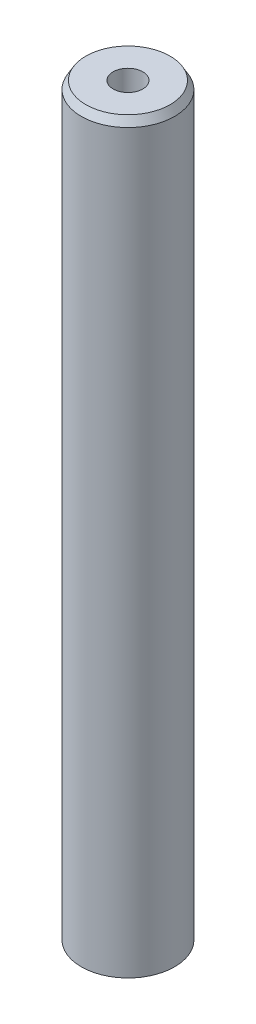
from build123d import *
from OCP.BRepFilletAPI import BRepFilletAPI_MakeChamfer

# Parameters (mm, degrees)
SKETCH1_R           = 22.5
BOSS_EXTRUDE1_DEPTH = 361.108329031
SKETCH2_R           = 7.172025744
CUT_EXTRUDE1_DEPTH  = 363.507552054
CHAMFER1_SIZE       = 3.804431163
CHAMFER1_SIZE2      = 2.196489356


with BuildPart() as part:
    # Sketch1 → Boss-Extrude1 (new body)
    with BuildSketch(Plane(origin=(0, 0, 0), x_dir=(1, 0, 0), z_dir=(0, 1, 0))):
        Circle(SKETCH1_R)
    extrude(amount=BOSS_EXTRUDE1_DEPTH)

    # Sketch2 → Cut-Extrude1 (cut, through all)
    with BuildSketch(Plane(origin=(0, 0, 0), x_dir=(1, 0, 0), z_dir=(0, 1, 0))):
        Circle(SKETCH2_R)
    extrude(amount=CUT_EXTRUDE1_DEPTH, mode=Mode.SUBTRACT)

    # Chamfer1: one chamfer whose edges measure the first distance from different faces: ONE call of the kernel's chamfer builder (chamfer() names one face for all edges)
    chamfer1_edges_1 = [part.edges().sort_by_distance(p)[0] for p in [
        (-22.5, 361.108329031, 0),
    ]]
    chamfer1_side_1 = [part.faces().sort_by_distance(p)[0] for p in [
        (-22.5, 180.554164516, 0),
    ]]
    chamfer1_edges_2 = [part.edges().sort_by_distance(p)[0] for p in [
        (-22.5, 0, 0),
    ]]
    chamfer1_side_2 = [part.faces().sort_by_distance(p)[0] for p in [
        (-21.863603897, 0, 0),
    ]]
    chamfer1 = BRepFilletAPI_MakeChamfer(part.part.solid().wrapped)
    for e in chamfer1_edges_1:
        chamfer1.Add(CHAMFER1_SIZE, CHAMFER1_SIZE2, e.wrapped, chamfer1_side_1[0].wrapped)  # the first distance lies on this face
    for e in chamfer1_edges_2:
        chamfer1.Add(CHAMFER1_SIZE, CHAMFER1_SIZE2, e.wrapped, chamfer1_side_2[0].wrapped)  # the first distance lies on this face
    add(Compound.cast(chamfer1.Shape()), mode=Mode.REPLACE)


solid = part.part
